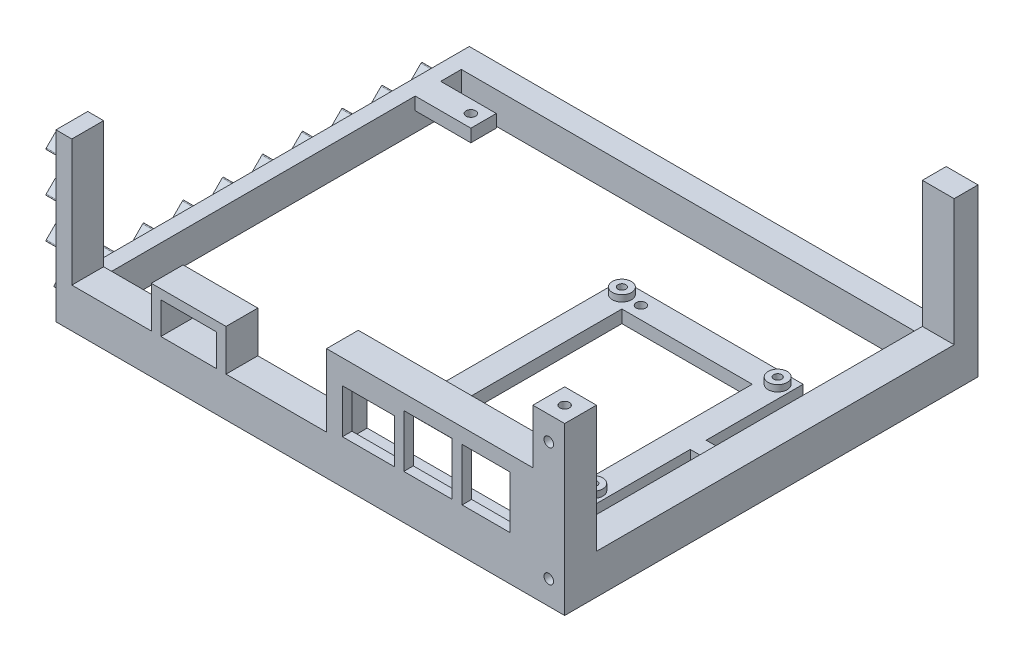
from build123d import *

# Parameters (mm, degrees)
SKETCH1_W           = 160
SKETCH1_H           = 130
BOSS_EXTRUDE1_DEPTH = 10
BOSS_EXTRUDE2_DEPTH = 42.3
CUT_EXTRUDE3_DEPTH  = 5.25
SKETCH9_R           = 1.5
CUT_EXTRUDE4_DEPTH  = 116.06211366
SKETCH11_W          = 112.5
SKETCH11_H          = 39.8
CUT_EXTRUDE5_DEPTH  = 172.640001165
SKETCH14_R          = 1.5
SKETCH14_W          = 41
SKETCH14_H          = 50
SKETCH14_R_2        = 1.25
BOSS_EXTRUDE7_DEPTH = 10
SKETCH14_3_R        = 3
SKETCH14_3_R_2      = 1.25
BOSS_EXTRUDE8_DEPTH = 12
SKETCH15_R          = 1.5
CUT_EXTRUDE7_DEPTH  = 4
CUT_EXTRUDE8_START  = -4
SKETCH16_R          = 1.5
CUT_EXTRUDE8_DEPTH  = 4
SKETCH17_W          = 17.5
SKETCH17_H          = 8
CUT_EXTRUDE9_DEPTH  = 6
SKETCH18_W          = 62.5
SKETCH18_H          = 80.5
CUT_EXTRUDE10_DEPTH = 6
SKETCH19_R          = 1.5
CUT_EXTRUDE11_DEPTH = 4
SKETCH21_W          = 16.4
SKETCH21_H          = 13.9
SKETCH21_W_2        = 15.2
SKETCH21_H_2        = 16.58376534
SKETCH21_W_3        = 15
SKETCH21_H_3        = 16.5018301
SKETCH21_W_4        = 17.5
SKETCH21_H_4        = 10
CUT_EXTRUDE14_DEPTH = 10
SKETCH22_W          = 57
SKETCH22_H          = 22.25
CUT_EXTRUDE16_DEPTH = 7
BOSS_EXTRUDE9_DEPTH = 5


with BuildPart() as part:
    # Sketch1 → Boss-Extrude1 (new body)
    with BuildSketch(Plane(origin=(0, 0, 0), x_dir=(1, 0, 0), z_dir=(0, 1, 0))):
        with Locations((5, 0)):
            Rectangle(SKETCH1_W, SKETCH1_H)
    extrude(amount=BOSS_EXTRUDE1_DEPTH)

    # Sketch3 → Boss-Extrude2 (add)
    with BuildSketch(Plane(origin=(0, 10, 0), x_dir=(1, 0, 0), z_dir=(0, 1, 0))):
        Polygon((75, 65), (75, -55), (-75, -55), (-75, -65), (85, -65), (85, 65), align=None)
    extrude(amount=BOSS_EXTRUDE2_DEPTH)

    # Sketch8 → Cut-Extrude3 (cut)
    with BuildSketch(Plane(origin=(0, 0, -65), x_dir=(-1, 0, 0), z_dir=(0, 0, -1))):
        Polygon((-83.425, 31.15), (-80, 34.575), (-76.575, 31.15), (-80, 27.725), align=None)
        Polygon((-80, 40.225), (-83.425, 43.65), (-80, 47.075), (-76.575, 43.65), align=None)
        Polygon((-80, 15.225), (-83.425, 18.65), (-80, 22.075), (-76.575, 18.65), align=None)
        Polygon((0, 8.425), (-3.425, 5), (0, 1.575), (3.425, 5), align=None)
        Polygon((15.925, 5), (12.5, 8.425), (9.075, 5), (12.5, 1.575), align=None)
        Polygon((28.425, 5), (25, 8.425), (21.575, 5), (25, 1.575), align=None)
        Polygon((40.925, 5), (37.5, 8.425), (34.075, 5), (37.5, 1.575), align=None)
        Polygon((53.425, 5), (50, 8.425), (46.575, 5), (50, 1.575), align=None)
        Polygon((65.925, 5), (62.5, 8.425), (59.075, 5), (62.5, 1.575), align=None)
        Polygon((-9.075, 5), (-12.5, 8.425), (-15.925, 5), (-12.5, 1.575), align=None)
        Polygon((-21.575, 5), (-25, 8.425), (-28.425, 5), (-25, 1.575), align=None)
        Polygon((-34.075, 5), (-37.5, 8.425), (-40.925, 5), (-37.5, 1.575), align=None)
        Polygon((-46.575, 5), (-50, 8.425), (-53.425, 5), (-50, 1.575), align=None)
        Polygon((-59.075, 5), (-62.5, 8.425), (-65.925, 5), (-62.5, 1.575), align=None)
        Polygon((-71.575, 5), (-75, 8.425), (-78.425, 5), (-75, 1.575), align=None)
    extrude(amount=-CUT_EXTRUDE3_DEPTH, mode=Mode.SUBTRACT)

    # Sketch9 → Cut-Extrude4 (cut, through all)
    with BuildSketch(Plane(origin=(0, 10, 0), x_dir=(1, 0, 0), z_dir=(0, 1, 0))):
        with Locations((-56.5, 47)):
            Circle(SKETCH9_R)
        Polygon((-70, -55), (75, -55), (75, 57.5), (-70, 57.5), (-70, 51), (-52.5, 51), (-52.5, 43), (-70, 43), align=None)
    extrude(amount=-CUT_EXTRUDE4_DEPTH, mode=Mode.SUBTRACT)

    # Sketch11 → Cut-Extrude5 (cut, through all)
    with BuildSketch(Plane.ZY.offset(-75)):
        with Locations((-1.25, 32.4)):
            Rectangle(SKETCH11_W, SKETCH11_H)
    extrude(amount=-CUT_EXTRUDE5_DEPTH, mode=Mode.SUBTRACT)

    # Sketch14 → Boss-Extrude7 (add)
    with BuildSketch(Plane(origin=(0, 0, 0), x_dir=(1, 0, 0), z_dir=(0, 1, 0))):
        Polygon((69.5, -40.5), (69.5, -9.999989951), (75, -9.999989951), (75.01417657, -5.000010049), (69.5, -5.000010049), (69.5, 25.5), (12.5, 25.5), (12.5, -40.5), align=None)
        with Locations((59.5, -36.5)):
            Circle(SKETCH14_R, mode=Mode.SUBTRACT)
        with Locations((41, -7.5)):
            Rectangle(SKETCH14_W, SKETCH14_H, mode=Mode.SUBTRACT)
        with Locations((22.5, 21.5)):
            Circle(SKETCH14_R, mode=Mode.SUBTRACT)
        with Locations((16.5, -36.5)):
            Circle(SKETCH14_R_2, mode=Mode.SUBTRACT)
        with Locations((65.5, -36.5)):
            Circle(SKETCH14_R_2, mode=Mode.SUBTRACT)
        with Locations((16.5, 21.5)):
            Circle(SKETCH14_R_2, mode=Mode.SUBTRACT)
        with Locations((65.5, 21.5)):
            Circle(SKETCH14_R_2, mode=Mode.SUBTRACT)
    extrude(amount=BOSS_EXTRUDE7_DEPTH)

    # Sketch14<3> → Boss-Extrude8 (add)
    # profile 1 of 4: a face of its own
    with BuildSketch(Plane(origin=(0, 0, 0), x_dir=(1, 0, 0), z_dir=(0, 1, 0))):
        with Locations((16.5, -36.5)):
            Circle(SKETCH14_3_R)
        with Locations((16.5, -36.5)):
            Circle(SKETCH14_3_R_2, mode=Mode.SUBTRACT)
    # profile 2 of 4: a face of its own
    with BuildSketch(Plane(origin=(0, 0, 0), x_dir=(1, 0, 0), z_dir=(0, 1, 0))):
        with Locations((65.5, -36.5)):
            Circle(SKETCH14_3_R)
        with Locations((65.5, -36.5)):
            Circle(SKETCH14_3_R_2, mode=Mode.SUBTRACT)
    # profile 3 of 4: a face of its own
    with BuildSketch(Plane(origin=(0, 0, 0), x_dir=(1, 0, 0), z_dir=(0, 1, 0))):
        with Locations((16.5, 21.5)):
            Circle(SKETCH14_3_R)
        with Locations((16.5, 21.5)):
            Circle(SKETCH14_3_R_2, mode=Mode.SUBTRACT)
    # profile 4 of 4: a face of its own
    with BuildSketch(Plane(origin=(0, 0, 0), x_dir=(1, 0, 0), z_dir=(0, 1, 0))):
        with Locations((65.5, 21.5)):
            Circle(SKETCH14_3_R)
        with Locations((65.5, 21.5)):
            Circle(SKETCH14_3_R_2, mode=Mode.SUBTRACT)
    extrude(amount=BOSS_EXTRUDE8_DEPTH)

    # Sketch15 → Cut-Extrude7 (cut)
    with BuildSketch(Plane(origin=(0, 52.3, 0), x_dir=(1, 0, 0), z_dir=(0, 1, 0))):
        with Locations((80, -60)):
            Circle(SKETCH15_R)
    extrude(amount=-CUT_EXTRUDE7_DEPTH, mode=Mode.SUBTRACT)

    # Sketch16 → Cut-Extrude8 (cut)
    with BuildSketch(Plane.XZ.offset(CUT_EXTRUDE8_START)):
        with Locations((80, 60)):
            Circle(SKETCH16_R)
    extrude(amount=CUT_EXTRUDE8_DEPTH, mode=Mode.SUBTRACT)

    # Sketch17 → Cut-Extrude9 (cut)
    with BuildSketch(Plane.XZ):
        with Locations((-61.25, -47)):
            Rectangle(SKETCH17_W, SKETCH17_H)
    extrude(amount=-CUT_EXTRUDE9_DEPTH, mode=Mode.SUBTRACT)

    # Sketch18 → Cut-Extrude10 (cut)
    with BuildSketch(Plane.XZ):
        with Locations((43.75, 14.75)):
            Rectangle(SKETCH18_W, SKETCH18_H)
    extrude(amount=-CUT_EXTRUDE10_DEPTH, mode=Mode.SUBTRACT)

    # Sketch19 → Cut-Extrude11 (cut)
    with BuildSketch(Plane.XY.offset(65)):
        with Locations((80, 7.5)):
            Circle(SKETCH19_R)
        with Locations((80, 44.8)):
            Circle(SKETCH19_R)
    extrude(amount=-CUT_EXTRUDE11_DEPTH, mode=Mode.SUBTRACT)

    # Sketch21 → Cut-Extrude14 (cut)
    with BuildSketch(Plane.XY.offset(65)):
        Polygon((-70, 52.3), (-70, 12.5), (-45, 12.5), (-45, 25.5), (-21.5, 25.5), (-21.5, 12.5), (10.1, 12.5), (10.1, 35.25), (75, 35.25), (75, 52.3), align=None)
        with Locations((23.3, 20.7)):
            Rectangle(SKETCH21_W, SKETCH21_H)
        with Locations((42, 22.25)):
            Rectangle(SKETCH21_W_2, SKETCH21_H_2)
        with Locations((60.25, 22.25)):
            Rectangle(SKETCH21_W_3, SKETCH21_H_3)
        with Locations((-33.25, 17.5)):
            Rectangle(SKETCH21_W_4, SKETCH21_H_4)
    extrude(amount=-CUT_EXTRUDE14_DEPTH, mode=Mode.SUBTRACT)

    # Sketch22 → Cut-Extrude16 (cut)
    with BuildSketch(Plane(origin=(0, 0, 55), x_dir=(-1, 0, 0), z_dir=(0, 0, -1))):
        with Locations((-41.4, 21.125)):
            Rectangle(SKETCH22_W, SKETCH22_H)
    extrude(amount=-CUT_EXTRUDE16_DEPTH, mode=Mode.SUBTRACT)

    # Sketch10 → Boss-Extrude9 (add)
    with BuildSketch(Plane.ZY.offset(75)):
        with BuildLine():
            Line((10.537867966, 5.212132034), (7.712132034, 8.037867966))
            ThreePointArc((7.712132034, 8.037867966), (7.5, 8.125735931), (7.287867966, 8.037867966))
            Line((7.287867966, 8.037867966), (4.462132034, 5.212132034))
            ThreePointArc((4.462132034, 5.212132034), (4.374264069, 5), (4.462132034, 4.787867966))
            Line((4.462132034, 4.787867966), (7.287867966, 1.962132034))
            ThreePointArc((7.287867966, 1.962132034), (7.5, 1.874264069), (7.712132034, 1.962132034))
            Line((7.712132034, 1.962132034), (10.537867966, 4.787867966))
            ThreePointArc((10.537867966, 4.787867966), (10.625735931, 5), (10.537867966, 5.212132034))
        make_face()
        with BuildLine():
            Line((56.962132034, 31.362132034), (59.787867966, 34.187867966))
            ThreePointArc((59.787867966, 34.187867966), (60, 34.275735931), (60.212132034, 34.187867966))
            Line((60.212132034, 34.187867966), (63.037867966, 31.362132034))
            ThreePointArc((63.037867966, 31.362132034), (63.125735931, 31.15), (63.037867966, 30.937867966))
            Line((63.037867966, 30.937867966), (60.212132034, 28.112132034))
            ThreePointArc((60.212132034, 28.112132034), (60, 28.024264069), (59.787867966, 28.112132034))
            Line((59.787867966, 28.112132034), (56.962132034, 30.937867966))
            ThreePointArc((56.962132034, 30.937867966), (56.874264069, 31.15), (56.962132034, 31.362132034))
        make_face()
        with BuildLine():
            Line((-5.212132034, 8.037867966), (-8.037867966, 5.212132034))
            ThreePointArc((-8.037867966, 5.212132034), (-8.125735931, 5), (-8.037867966, 4.787867966))
            Line((-8.037867966, 4.787867966), (-5.212132034, 1.962132034))
            ThreePointArc((-5.212132034, 1.962132034), (-5, 1.874264069), (-4.787867966, 1.962132034))
            Line((-4.787867966, 1.962132034), (-1.962132034, 4.787867966))
            ThreePointArc((-1.962132034, 4.787867966), (-1.874264069, 5), (-1.962132034, 5.212132034))
            Line((-1.962132034, 5.212132034), (-4.787867966, 8.037867966))
            ThreePointArc((-4.787867966, 8.037867966), (-5, 8.125735931), (-5.212132034, 8.037867966))
        make_face()
        with BuildLine():
            Line((59.787867966, 40.612132034), (56.962132034, 43.437867966))
            ThreePointArc((56.962132034, 43.437867966), (56.874264069, 43.65), (56.962132034, 43.862132034))
            Line((56.962132034, 43.862132034), (59.787867966, 46.687867966))
            ThreePointArc((59.787867966, 46.687867966), (60, 46.775735931), (60.212132034, 46.687867966))
            Line((60.212132034, 46.687867966), (63.037867966, 43.862132034))
            ThreePointArc((63.037867966, 43.862132034), (63.125735931, 43.65), (63.037867966, 43.437867966))
            Line((63.037867966, 43.437867966), (60.212132034, 40.612132034))
            ThreePointArc((60.212132034, 40.612132034), (60, 40.524264069), (59.787867966, 40.612132034))
        make_face()
        with BuildLine():
            Line((59.787867966, 15.612132034), (56.962132034, 18.437867966))
            ThreePointArc((56.962132034, 18.437867966), (56.874264069, 18.65), (56.962132034, 18.862132034))
            Line((56.962132034, 18.862132034), (59.787867966, 21.687867966))
            ThreePointArc((59.787867966, 21.687867966), (60, 21.775735931), (60.212132034, 21.687867966))
            Line((60.212132034, 21.687867966), (63.037867966, 18.862132034))
            ThreePointArc((63.037867966, 18.862132034), (63.125735931, 18.65), (63.037867966, 18.437867966))
            Line((63.037867966, 18.437867966), (60.212132034, 15.612132034))
            ThreePointArc((60.212132034, 15.612132034), (60, 15.524264069), (59.787867966, 15.612132034))
        make_face()
        with BuildLine():
            Line((23.037867966, 5.212132034), (20.212132034, 8.037867966))
            ThreePointArc((20.212132034, 8.037867966), (20, 8.125735931), (19.787867966, 8.037867966))
            Line((19.787867966, 8.037867966), (16.962132034, 5.212132034))
            ThreePointArc((16.962132034, 5.212132034), (16.874264069, 5), (16.962132034, 4.787867966))
            Line((16.962132034, 4.787867966), (19.787867966, 1.962132034))
            ThreePointArc((19.787867966, 1.962132034), (20, 1.874264069), (20.212132034, 1.962132034))
            Line((20.212132034, 1.962132034), (23.037867966, 4.787867966))
            ThreePointArc((23.037867966, 4.787867966), (23.125735931, 5), (23.037867966, 5.212132034))
        make_face()
        with BuildLine():
            Line((35.537867966, 5.212132034), (32.712132034, 8.037867966))
            ThreePointArc((32.712132034, 8.037867966), (32.5, 8.125735931), (32.287867966, 8.037867966))
            Line((32.287867966, 8.037867966), (29.462132034, 5.212132034))
            ThreePointArc((29.462132034, 5.212132034), (29.374264069, 5), (29.462132034, 4.787867966))
            Line((29.462132034, 4.787867966), (32.287867966, 1.962132034))
            ThreePointArc((32.287867966, 1.962132034), (32.5, 1.874264069), (32.712132034, 1.962132034))
            Line((32.712132034, 1.962132034), (35.537867966, 4.787867966))
            ThreePointArc((35.537867966, 4.787867966), (35.625735931, 5), (35.537867966, 5.212132034))
        make_face()
        with BuildLine():
            Line((48.037867966, 5.212132034), (45.212132034, 8.037867966))
            ThreePointArc((45.212132034, 8.037867966), (45, 8.125735931), (44.787867966, 8.037867966))
            Line((44.787867966, 8.037867966), (41.962132034, 5.212132034))
            ThreePointArc((41.962132034, 5.212132034), (41.874264069, 5), (41.962132034, 4.787867966))
            Line((41.962132034, 4.787867966), (44.787867966, 1.962132034))
            ThreePointArc((44.787867966, 1.962132034), (45, 1.874264069), (45.212132034, 1.962132034))
            Line((45.212132034, 1.962132034), (48.037867966, 4.787867966))
            ThreePointArc((48.037867966, 4.787867966), (48.125735931, 5), (48.037867966, 5.212132034))
        make_face()
        with BuildLine():
            Line((60.537867966, 5.212132034), (57.712132034, 8.037867966))
            ThreePointArc((57.712132034, 8.037867966), (57.5, 8.125735931), (57.287867966, 8.037867966))
            Line((57.287867966, 8.037867966), (54.462132034, 5.212132034))
            ThreePointArc((54.462132034, 5.212132034), (54.374264069, 5), (54.462132034, 4.787867966))
            Line((54.462132034, 4.787867966), (57.287867966, 1.962132034))
            ThreePointArc((57.287867966, 1.962132034), (57.5, 1.874264069), (57.712132034, 1.962132034))
            Line((57.712132034, 1.962132034), (60.537867966, 4.787867966))
            ThreePointArc((60.537867966, 4.787867966), (60.625735931, 5), (60.537867966, 5.212132034))
        make_face()
        with BuildLine():
            Line((-14.462132034, 5.212132034), (-17.287867966, 8.037867966))
            ThreePointArc((-17.287867966, 8.037867966), (-17.5, 8.125735931), (-17.712132034, 8.037867966))
            Line((-17.712132034, 8.037867966), (-20.537867966, 5.212132034))
            ThreePointArc((-20.537867966, 5.212132034), (-20.625735931, 5), (-20.537867966, 4.787867966))
            Line((-20.537867966, 4.787867966), (-17.712132034, 1.962132034))
            ThreePointArc((-17.712132034, 1.962132034), (-17.5, 1.874264069), (-17.287867966, 1.962132034))
            Line((-17.287867966, 1.962132034), (-14.462132034, 4.787867966))
            ThreePointArc((-14.462132034, 4.787867966), (-14.374264069, 5), (-14.462132034, 5.212132034))
        make_face()
        with BuildLine():
            Line((-26.962132034, 5.212132034), (-29.787867966, 8.037867966))
            ThreePointArc((-29.787867966, 8.037867966), (-30, 8.125735931), (-30.212132034, 8.037867966))
            Line((-30.212132034, 8.037867966), (-33.037867966, 5.212132034))
            ThreePointArc((-33.037867966, 5.212132034), (-33.125735931, 5), (-33.037867966, 4.787867966))
            Line((-33.037867966, 4.787867966), (-30.212132034, 1.962132034))
            ThreePointArc((-30.212132034, 1.962132034), (-30, 1.874264069), (-29.787867966, 1.962132034))
            Line((-29.787867966, 1.962132034), (-26.962132034, 4.787867966))
            ThreePointArc((-26.962132034, 4.787867966), (-26.874264069, 5), (-26.962132034, 5.212132034))
        make_face()
        with BuildLine():
            Line((-39.462132034, 5.212132034), (-42.287867966, 8.037867966))
            ThreePointArc((-42.287867966, 8.037867966), (-42.5, 8.125735931), (-42.712132034, 8.037867966))
            Line((-42.712132034, 8.037867966), (-45.537867966, 5.212132034))
            ThreePointArc((-45.537867966, 5.212132034), (-45.625735931, 5), (-45.537867966, 4.787867966))
            Line((-45.537867966, 4.787867966), (-42.712132034, 1.962132034))
            ThreePointArc((-42.712132034, 1.962132034), (-42.5, 1.874264069), (-42.287867966, 1.962132034))
            Line((-42.287867966, 1.962132034), (-39.462132034, 4.787867966))
            ThreePointArc((-39.462132034, 4.787867966), (-39.374264069, 5), (-39.462132034, 5.212132034))
        make_face()
        with BuildLine():
            Line((-51.962132034, 5.212132034), (-54.787867966, 8.037867966))
            ThreePointArc((-54.787867966, 8.037867966), (-55, 8.125735931), (-55.212132034, 8.037867966))
            Line((-55.212132034, 8.037867966), (-58.037867966, 5.212132034))
            ThreePointArc((-58.037867966, 5.212132034), (-58.125735931, 5), (-58.037867966, 4.787867966))
            Line((-58.037867966, 4.787867966), (-55.212132034, 1.962132034))
            ThreePointArc((-55.212132034, 1.962132034), (-55, 1.874264069), (-54.787867966, 1.962132034))
            Line((-54.787867966, 1.962132034), (-51.962132034, 4.787867966))
            ThreePointArc((-51.962132034, 4.787867966), (-51.874264069, 5), (-51.962132034, 5.212132034))
        make_face()
    extrude(amount=BOSS_EXTRUDE9_DEPTH)


solid = part.part
